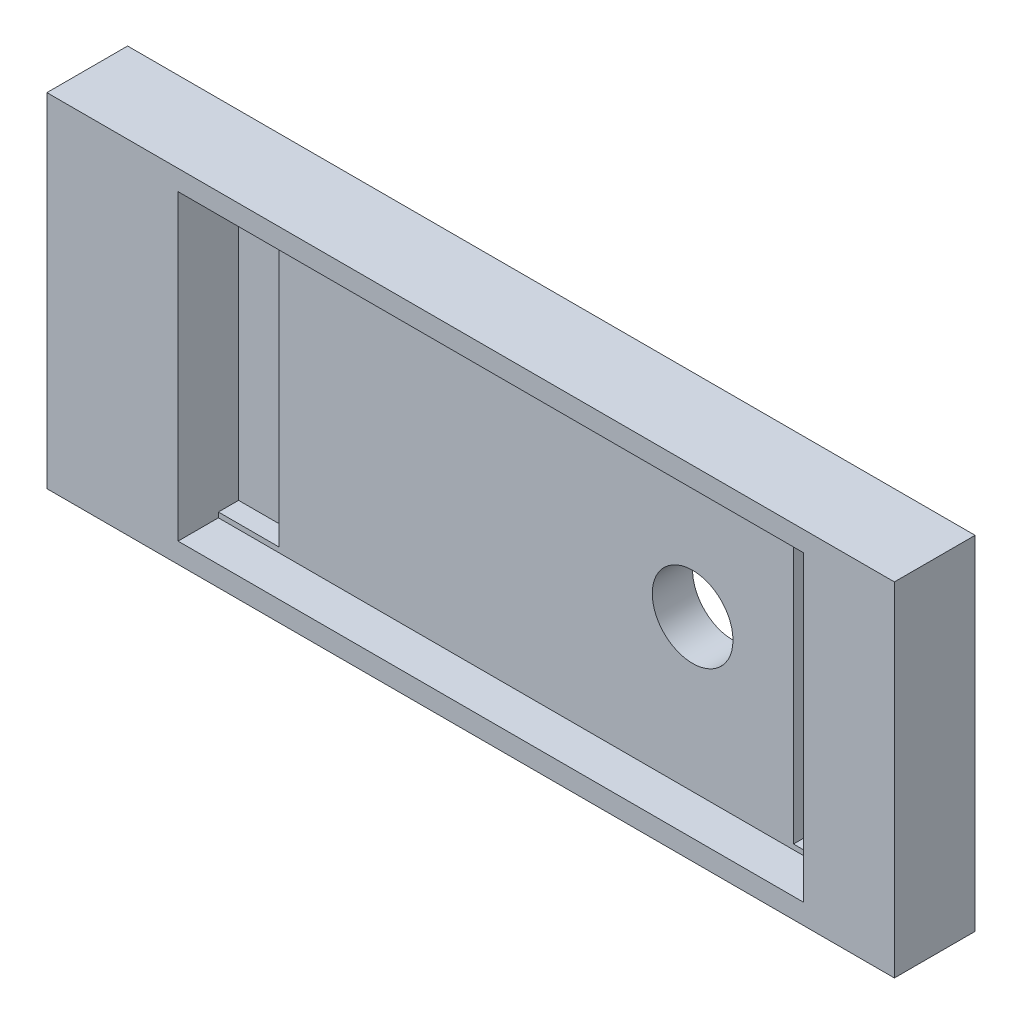
from build123d import *

# Parameters (mm, degrees)
SKETCH_1_R          = 2
EXTRUDE_1_DEPTH     = 2
SKETCH_3_W          = 3
SKETCH_3_H          = 14.5
SKETCH_3_W_2        = 2.5
CUT_EXTRUDE_1_DEPTH = 1
SKETCH_4_W          = 42
SKETCH_4_H          = 17
SKETCH_4_W_2        = 40
SKETCH_4_H_2        = 15
EXTRUDE_2_DEPTH     = 1
SKETCH_6_W          = 5.5
SKETCH_6_H          = 15
SKETCH_6_W_2        = 3.5
EXTRUDE_4_DEPTH     = 1
SKETCH_7_W          = 42
SKETCH_7_H          = 17
SKETCH_7_W_2        = 31
SKETCH_7_H_2        = 15
EXTRUDE_5_DEPTH     = 1


with BuildPart() as part:
    # 草图1 → 凸台-拉伸1 (new body)
    with BuildSketch(Plane.XY):
        Polygon((-30, 8.5), (-30, -8.5), (12, -8.5), (12, 0), (12, 8.5), align=None)
        Circle(SKETCH_1_R, mode=Mode.SUBTRACT)
    extrude(amount=EXTRUDE_1_DEPTH)

    # 草图3 → 切除-拉伸1 (cut)
    with BuildSketch(Plane.XY.offset(2)):
        with Locations((-22, 0)):
            Rectangle(SKETCH_3_W, SKETCH_3_H)
        with Locations((6.25, 0)):
            Rectangle(SKETCH_3_W_2, SKETCH_3_H)
    extrude(amount=-CUT_EXTRUDE_1_DEPTH, mode=Mode.SUBTRACT)

    # 草图4 → 凸台-拉伸2 (add)
    with BuildSketch(Plane.XY.offset(2)):
        with Locations((-9, 0)):
            Rectangle(SKETCH_4_W, SKETCH_4_H)
        with Locations((-9, 0)):
            Rectangle(SKETCH_4_W_2, SKETCH_4_H_2, mode=Mode.SUBTRACT)
    extrude(amount=EXTRUDE_2_DEPTH)

    # 草图6 → 凸台-拉伸4 (add)
    with BuildSketch(Plane.XY.offset(2)):
        with Locations((-26.25, 0)):
            Rectangle(SKETCH_6_W, SKETCH_6_H)
        with Locations((9.25, 0)):
            Rectangle(SKETCH_6_W_2, SKETCH_6_H)
    extrude(amount=EXTRUDE_4_DEPTH)

    # 草图7 → 凸台-拉伸5 (add)
    with BuildSketch(Plane.XY.offset(3)):
        with Locations((-9, 0)):
            Rectangle(SKETCH_7_W, SKETCH_7_H)
        with Locations((-8, 0)):
            Rectangle(SKETCH_7_W_2, SKETCH_7_H_2, mode=Mode.SUBTRACT)
    extrude(amount=EXTRUDE_5_DEPTH)


solid = part.part
